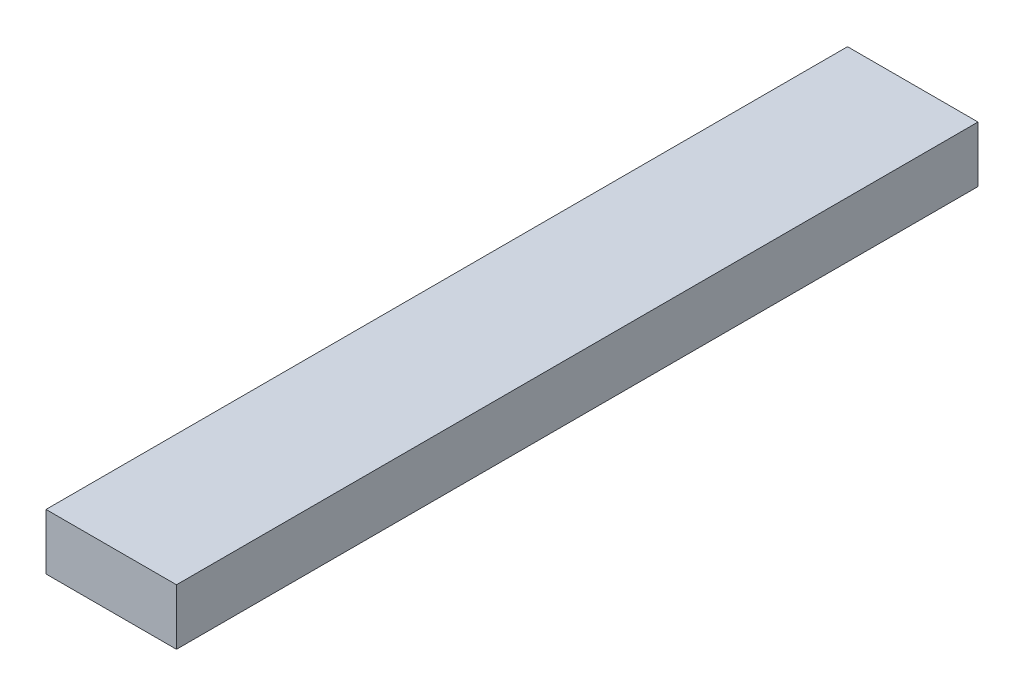
from build123d import *

# Parameters (mm, degrees)
SKETCH1_W           = 88.9
SKETCH1_H           = 38.1
BOSS_EXTRUDE1_DEPTH = 546.1


with BuildPart() as part:
    # Sketch1 → Boss-Extrude1 (new body)
    with BuildSketch(Plane.XY):
        with Locations((44.45, 19.05)):
            Rectangle(SKETCH1_W, SKETCH1_H)
    extrude(amount=BOSS_EXTRUDE1_DEPTH)


solid = part.part
